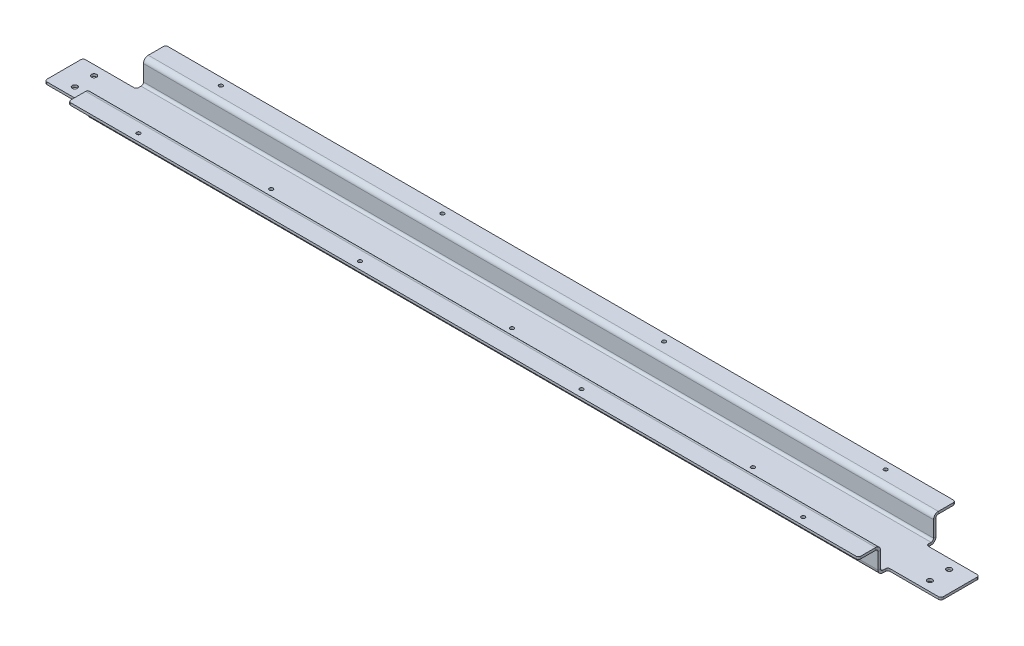
from build123d import *

# Parameters (mm, degrees)
BASE_FLANGE2_DEPTH                     = 3.175
EDGE_FLANGE1_STRIP_W                   = 19.05
EDGE_FLANGE1_STRIP_H                   = 3.175
EDGE_FLANGE1_STRIP_CUT_DEPTH           = 1041.4
EDGE_FLANGE1_STRIP_2_W                 = 19.05
EDGE_FLANGE1_STRIP_2_H                 = 3.175
EDGE_FLANGE1_STRIP_CUT_2_DEPTH         = 1041.4
EDGE_FLANGE1_DEPTH                     = 1041.4
EDGE_FLANGE1_BEND_DEPTH                = 1041.4
EDGE_FLANGE3_START                     = -520.7
EDGE_FLANGE3_DEPTH                     = 1041.4
F_10_0_1935_DIAMETER_HOLE1_D           = 4.9149
F_10_0_1935_DIAMETER_HOLE1_ON_FACE_2_D = 4.9149
F_10_0_1935_DIAMETER_HOLE1_ON_FACE_3_D = 4.9149
F_17_64_0_26563_DIAMETER_HOLE1_D       = 6.747002
FILLET1_R                              = 3.175


# Read off the part's stored shape, not the designer's step: Edge-Flange3
# Sheet-metal steps are written as plain solids
with BuildPart() as part:
    # Sketch1 → Base-Flange2 (new body)
    with BuildSketch(Plane(origin=(0, 0, 0), x_dir=(1, 0, 0), z_dir=(0, 1, 0))):
        with BuildLine():
            Line((-520.7, 28.575), (-520.7, 38.1))
            Line((-520.7, 38.1), (520.7, 38.1))
            Line((520.7, 38.1), (520.7, 28.575))
            ThreePointArc((520.7, 28.575), (521.62993597, 26.32993597), (523.875, 25.4))
            Line((523.875, 25.4), (590.7405, 25.4))
            Line((590.7405, 25.4), (590.7405, -25.4))
            Line((590.7405, -25.4), (523.875, -25.4))
            ThreePointArc((523.875, -25.4), (521.62993597, -26.32993597), (520.7, -28.575))
            Line((520.7, -28.575), (520.7, -38.1))
            Line((520.7, -38.1), (-520.7, -38.1))
            Line((-520.7, -38.1), (-520.7, -28.575))
            ThreePointArc((-520.7, -28.575), (-521.62993597, -26.32993597), (-523.875, -25.4))
            Line((-523.875, -25.4), (-590.7405, -25.4))
            Line((-590.7405, -25.4), (-590.7405, 25.4))
            Line((-590.7405, 25.4), (-523.875, 25.4))
            ThreePointArc((-523.875, 25.4), (-521.62993597, 26.32993597), (-520.7, 28.575))
        make_face()
    extrude(amount=-BASE_FLANGE2_DEPTH)

    # Edge-Flange1 strip (across the edge) → Edge-Flange1 strip cut (cut)
    with BuildSketch(Plane(origin=(-520.7, 0, 38.1), x_dir=(0, 0, -1), z_dir=(1, 0, 0))):
        with Locations((-3.175, -1.5875)):
            Rectangle(EDGE_FLANGE1_STRIP_W, EDGE_FLANGE1_STRIP_H)
    extrude(amount=EDGE_FLANGE1_STRIP_CUT_DEPTH, mode=Mode.SUBTRACT)

    # Edge-Flange1 strip 2 (across the edge) → Edge-Flange1 strip cut 2 (cut)
    with BuildSketch(Plane(origin=(520.7, 0, -38.1), x_dir=(0, 0, 1), z_dir=(-1, 0, 0))):
        with Locations((-3.175, -1.5875)):
            Rectangle(EDGE_FLANGE1_STRIP_2_W, EDGE_FLANGE1_STRIP_2_H)
    extrude(amount=EDGE_FLANGE1_STRIP_CUT_2_DEPTH, mode=Mode.SUBTRACT)

    # Edge-Flange1 section (across the edge) → Edge-Flange1 (add)
    with BuildSketch(Plane(origin=(-520.7, 0, 38.1), x_dir=(0, 0, -1), z_dir=(1, 0, 0))):
        with BuildLine():
            Line((0, 3.175), (0, 17.145))
            Line((0, 17.145), (3.175, 17.145))
            Line((3.175, 17.145), (3.175, 3.175))
            ThreePointArc((3.175, 3.175), (4.10493597, 0.92993597), (6.35, 0))
            Line((6.35, 0), (6.35, -3.175))
            ThreePointArc((6.35, -3.175), (1.859871939, -1.315128061), (0, 3.175))
        make_face()
    extrude(amount=EDGE_FLANGE1_DEPTH)

    # Edge-Flange1 section 2 (across the edge) → Edge-Flange1 bend (add)
    with BuildSketch(Plane(origin=(520.7, 0, -38.1), x_dir=(0, 0, 1), z_dir=(-1, 0, 0))):
        with BuildLine():
            Line((0, 3.175), (0, 17.145))
            Line((0, 17.145), (3.175, 17.145))
            Line((3.175, 17.145), (3.175, 3.175))
            ThreePointArc((3.175, 3.175), (4.10493597, 0.92993597), (6.35, 0))
            Line((6.35, 0), (6.35, -3.175))
            ThreePointArc((6.35, -3.175), (1.859871939, -1.315128061), (0, 3.175))
        make_face()
    extrude(amount=EDGE_FLANGE1_BEND_DEPTH)

    # Edge-Flange3 outline → Edge-Flange3 (add)
    with BuildSketch(Plane.YZ.offset(EDGE_FLANGE3_START)):
        with BuildLine():
            Line((24.257, 38.1), (17.145, 38.1))
            Line((17.145, 38.1), (17.145, 34.925))
            Line((17.145, 34.925), (24.257, 34.925))
            ThreePointArc((24.257, 34.925), (28.747128061, 36.784871939), (30.607, 41.275))
            Line((30.607, 41.275), (30.607, 64.135))
            Line((30.607, 64.135), (27.432, 64.135))
            Line((27.432, 64.135), (27.432, 41.275))
            ThreePointArc((27.432, 41.275), (26.50206403, 39.02993597), (24.257, 38.1))
        make_face()
        with BuildLine():
            Line((17.145, -38.1), (24.257, -38.1))
            ThreePointArc((24.257, -38.1), (26.50206403, -39.02993597), (27.432, -41.275))
            Line((27.432, -41.275), (27.432, -64.135))
            Line((27.432, -64.135), (30.607, -64.135))
            Line((30.607, -64.135), (30.607, -41.275))
            ThreePointArc((30.607, -41.275), (28.747128061, -36.784871939), (24.257, -34.925))
            Line((24.257, -34.925), (17.145, -34.925))
            Line((17.145, -34.925), (17.145, -38.1))
        make_face()
    extrude(amount=EDGE_FLANGE3_DEPTH)

    # #10 (0.1935) Diameter Hole1 (through all)
    with Locations(Plane(origin=(-317.5, -3.175, 0), x_dir=(0, 0, -1), z_dir=(0, -1, 0))):
        with Locations((0, 0), (0, 635), (0, 317.5)):
            Hole(F_10_0_1935_DIAMETER_HOLE1_D / 2)

    # #10 (0.1935) Diameter Hole1 on face 2 (through all)
    with Locations(Plane.ZX):
        with Locations((0, 0)):
            Hole(F_10_0_1935_DIAMETER_HOLE1_ON_FACE_2_D / 2)

    # #10 (0.1935) Diameter Hole1 on face 3 (through all)
    with Locations(Plane(origin=(-438.15, 30.607, -54.356), x_dir=(0, 0, 1), z_dir=(0, 1, 0))):
        with Locations((0, 0), (0, 292.1), (0, 584.2), (0, 876.3), (108.712, 0), (108.712, 292.1), (108.712, 584.2), (108.712, 876.3)):
            Hole(F_10_0_1935_DIAMETER_HOLE1_ON_FACE_3_D / 2)

    # 17/64 (0.26563) Diameter Hole1 (through all)
    with Locations(Plane(origin=(-563.5625, 0, -12.7), x_dir=(0, 0, 1), z_dir=(0, 1, 0))):
        with Locations((0, 0), (25.4, 0), (0, 1127.125), (25.4, 1127.125)):
            Hole(F_17_64_0_26563_DIAMETER_HOLE1_D / 2)

    # Fillet1
    fillet1_edges = [part.edges().sort_by_distance(p)[0] for p in [
        (520.7, 29.0195, 64.135),
        (-520.7, 29.0195, 64.135),
        (-520.7, 29.0195, -64.135),
        (520.7, 29.0195, -64.135),
        (590.7405, -1.5875, -25.4),
        (590.7405, -1.5875, 25.4),
        (-590.7405, -1.5875, 25.4),
        (-590.7405, -1.5875, -25.4),
    ]]
    fillet(fillet1_edges, radius=FILLET1_R)


solid = part.part
